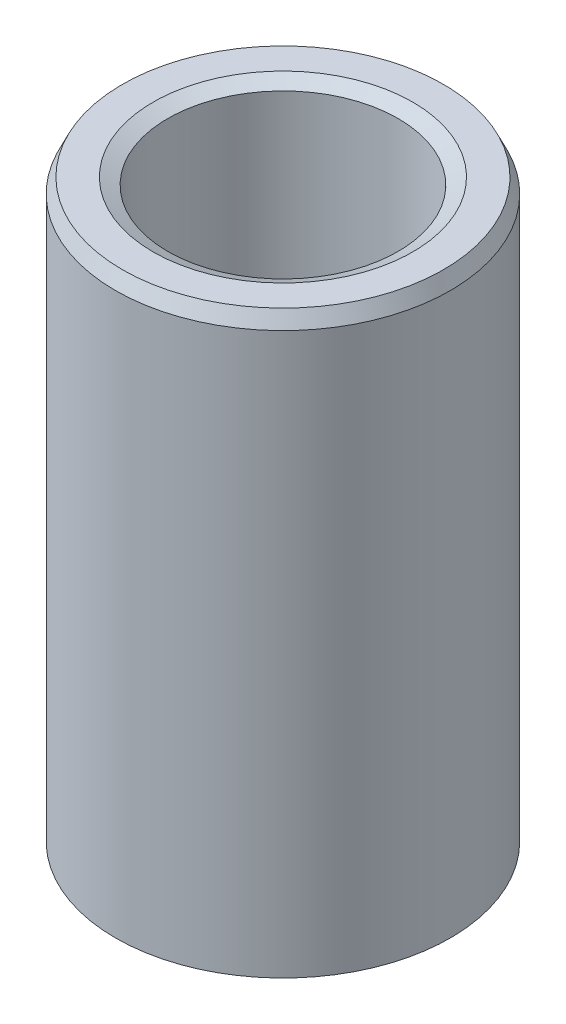
from build123d import *
from OCP.BRepFilletAPI import BRepFilletAPI_MakeChamfer

# Parameters (mm, degrees)
SKETCH1_R           = 15
BOSS_EXTRUDE1_DEPTH = 52.159047951
SKETCH2_R           = 10.318599918
CUT_EXTRUDE1_DEPTH  = 57.307781728
CHAMFER1_SIZE       = 1.31091887
CHAMFER1_SIZE2      = 0.61634912


with BuildPart() as part:
    # Sketch1 → Boss-Extrude1 (new body)
    with BuildSketch(Plane(origin=(0, 0, 0), x_dir=(1, 0, 0), z_dir=(0, 1, 0))):
        Circle(SKETCH1_R)
    extrude(amount=BOSS_EXTRUDE1_DEPTH)

    # Sketch2 → Cut-Extrude1 (cut, through all)
    with BuildSketch(Plane(origin=(0, 0, 0), x_dir=(1, 0, 0), z_dir=(0, 1, 0))):
        Circle(SKETCH2_R)
    extrude(amount=CUT_EXTRUDE1_DEPTH, mode=Mode.SUBTRACT)

    # Chamfer1: one chamfer whose edges measure the first distance from different faces: ONE call of the kernel's chamfer builder (chamfer() names one face for all edges)
    chamfer1_edges_1 = [part.edges().sort_by_distance(p)[0] for p in [
        (-10.318599918, 52.159047951, 0),
    ]]
    chamfer1_side_1 = [part.faces().sort_by_distance(p)[0] for p in [
        (-14.575735931, 52.159047951, 0),
    ]]
    chamfer1_edges_2 = [part.edges().sort_by_distance(p)[0] for p in [
        (-10.318599918, 0, 0),
    ]]
    chamfer1_side_2 = [part.faces().sort_by_distance(p)[0] for p in [
        (-10.318599918, 26.079523976, 0),
    ]]
    chamfer1_edges_3 = [part.edges().sort_by_distance(p)[0] for p in [
        (-15, 0, 0),
    ]]
    chamfer1_side_3 = [part.faces().sort_by_distance(p)[0] for p in [
        (-14.575735931, 0, 0),
    ]]
    chamfer1_edges_4 = [part.edges().sort_by_distance(p)[0] for p in [
        (-15, 52.159047951, 0),
    ]]
    chamfer1_side_4 = [part.faces().sort_by_distance(p)[0] for p in [
        (-15, 26.079523976, 0),
    ]]
    chamfer1 = BRepFilletAPI_MakeChamfer(part.part.solid().wrapped)
    for e in chamfer1_edges_1:
        chamfer1.Add(CHAMFER1_SIZE, CHAMFER1_SIZE2, e.wrapped, chamfer1_side_1[0].wrapped)  # the first distance lies on this face
    for e in chamfer1_edges_2:
        chamfer1.Add(CHAMFER1_SIZE, CHAMFER1_SIZE2, e.wrapped, chamfer1_side_2[0].wrapped)  # the first distance lies on this face
    for e in chamfer1_edges_3:
        chamfer1.Add(CHAMFER1_SIZE, CHAMFER1_SIZE2, e.wrapped, chamfer1_side_3[0].wrapped)  # the first distance lies on this face
    for e in chamfer1_edges_4:
        chamfer1.Add(CHAMFER1_SIZE, CHAMFER1_SIZE2, e.wrapped, chamfer1_side_4[0].wrapped)  # the first distance lies on this face
    add(Compound.cast(chamfer1.Shape()), mode=Mode.REPLACE)


solid = part.part
